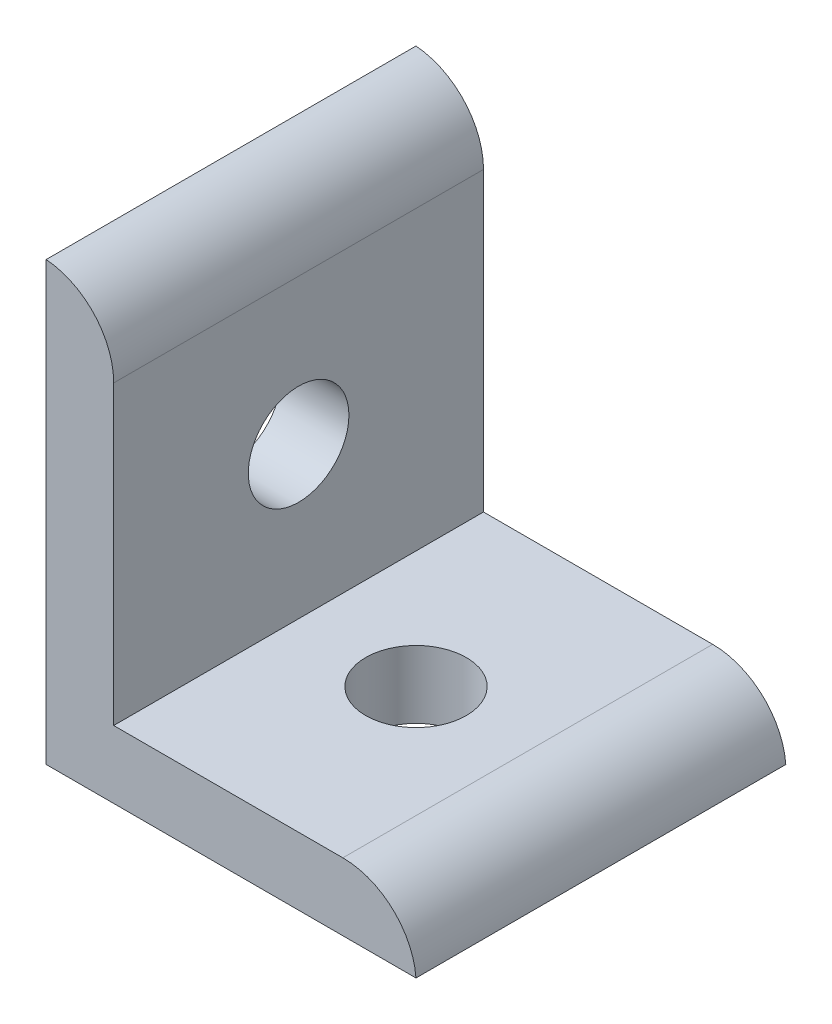
from build123d import *

# Parameters (mm, degrees)
SKETCH1_W           = 25.2
SKETCH1_H           = 25.2
SKETCH1_R           = 3.429
BOSS_EXTRUDE1_DEPTH = 4.6
SKETCH2_W           = 4.6
SKETCH2_H           = 25.2
BOSS_EXTRUDE2_DEPTH = 25.2
CUT_EXTRUDE1_REACH  = 46.13
SKETCH3_R           = 3.429
FILLET1_R           = 5


with BuildPart() as part:
    # Sketch1 → Boss-Extrude1 (new body)
    with BuildSketch(Plane(origin=(0, 0, 0), x_dir=(1, 0, 0), z_dir=(0, 1, 0))):
        with Locations((12.6, 12.6)):
            Rectangle(SKETCH1_W, SKETCH1_H)
        with Locations(Location((12.6, 12.6, 0), (0, 0, 270))):
            Circle(SKETCH1_R, mode=Mode.SUBTRACT)
    extrude(amount=BOSS_EXTRUDE1_DEPTH)

    # Sketch2 → Boss-Extrude2 (add)
    with BuildSketch(Plane(origin=(0, 4.6, 0), x_dir=(1, 0, 0), z_dir=(0, 1, 0))):
        with Locations((2.3, 12.6)):
            Rectangle(SKETCH2_W, SKETCH2_H)
    extrude(amount=BOSS_EXTRUDE2_DEPTH)

    # Sketch3 → Cut-Extrude1 (cut, up to next)
    with BuildSketch(Plane(origin=(4.6, 0, 0), x_dir=(0, 0, -1), z_dir=(1, 0, 0)), mode=Mode.PRIVATE) as cut_extrude1_sk1:
        with Locations((12.6, 14.9)):
            Circle(SKETCH3_R)
    cut_extrude1_tool1 = extrude(cut_extrude1_sk1.sketch, amount=-CUT_EXTRUDE1_REACH, mode=Mode.PRIVATE) & part.part
    add(cut_extrude1_tool1.solids().sort_by_distance((4.6, 14.9, -12.6))[0], mode=Mode.SUBTRACT)

    # Fillet1
    # the kernel refuses this fillet: 5 mm, written as the material it takes off along each edge
    with BuildSketch(Plane(origin=(4.6, 29.8, -37.659935794), x_dir=(-1, 0, 0), z_dir=(0, 0, 1))) as fillet1_piece_1:
        with BuildLine():
            CenterArc((5, 4.983974318), FILLET1_R, 180, 85.411434264)
            Line((0, 4.983974318), (-0.1, 4.983974318))
            Line((-0.1, 4.983974318), (-0.1, 0))
            Line((-0.1, 0), (0, -0.1))
            ThreePointArc((0, -0.1), (2.3, -0.1), (4.592, -0.099679486))
            Line((4.592, -0.099679486), (4.6, 0))
        make_face()
    extrude(amount=50.119871589, mode=Mode.SUBTRACT)
    with BuildSketch(Plane(origin=(25.2, 4.6, 12.459935794), x_dir=(-1, 0, 0), z_dir=(0, 0, -1))) as fillet1_piece_2:
        with BuildLine():
            CenterArc((4.983974318, -5), FILLET1_R, 90, 85.411434264)
            Line((0, -4.6), (-0.099679486, -4.592))
            ThreePointArc((-0.099679486, -4.592), (-0.1, -2.3), (-0.1, 0))
            Line((-0.1, 0), (0, 0.1))
            Line((0, 0.1), (4.983974318, 0.1))
            Line((4.983974318, 0.1), (4.983974318, 0))
        make_face()
    extrude(amount=50.119871589, mode=Mode.SUBTRACT)


solid = part.part
